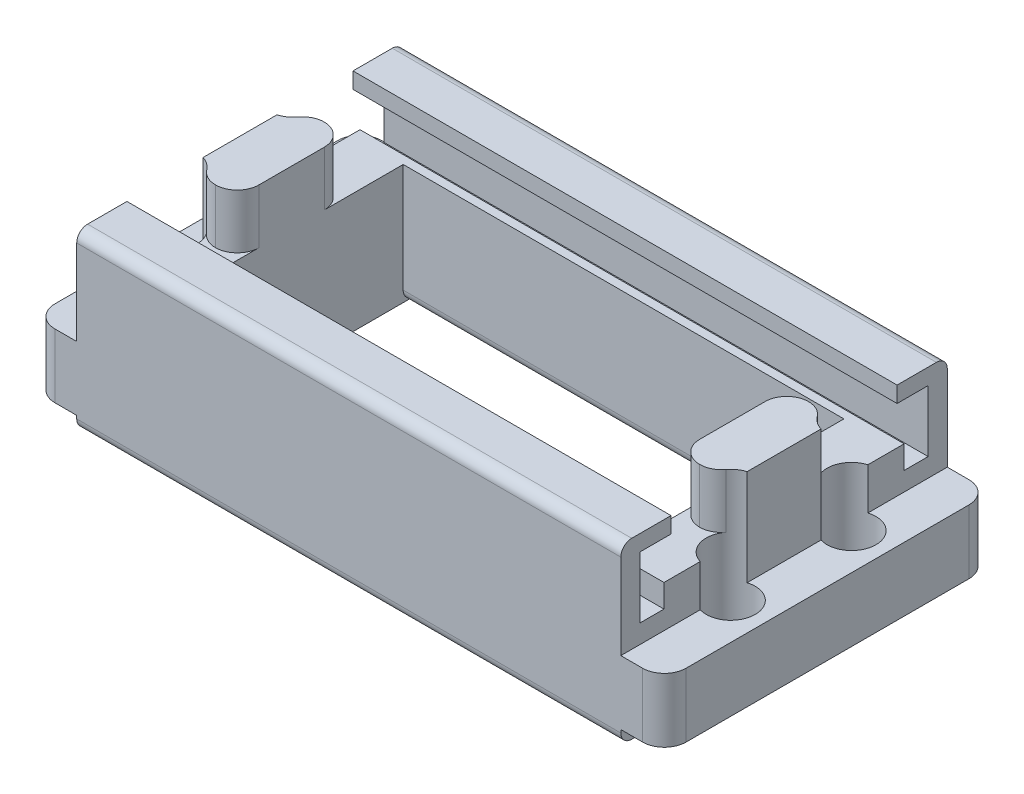
from build123d import *

# Parameters (mm, degrees)
SKETCH1_W           = 50
SKETCH1_H           = 30
BOSS_EXTRUDE1_DEPTH = 16
SKETCH2_W           = 40.5
SKETCH2_H           = 20.5
CUT_EXTRUDE1_DEPTH  = 61.464865831
SKETCH3_W           = 5.361453717
SKETCH3_H           = 2.1
SKETCH3_W_2         = 6
CUT_EXTRUDE2_DEPTH  = 1.25
SKETCH5_W           = 30
SKETCH5_H           = 5.881320982
BOSS_EXTRUDE2_DEPTH = 4
SKETCH4_R           = 2.25
CUT_EXTRUDE3_DEPTH  = 64.812224534
CUT_EXTRUDE4_DEPTH  = 64.812224534
FILLET1_R           = 1
FILLET2_R           = 2
FILLET3_R           = 2


with BuildPart() as part:
    # Sketch1 → Boss-Extrude1 (new body)
    with BuildSketch(Plane(origin=(0, 0, 0), x_dir=(1, 0, 0), z_dir=(0, 1, 0))):
        with Locations((25, 15)):
            Rectangle(SKETCH1_W, SKETCH1_H)
    extrude(amount=BOSS_EXTRUDE1_DEPTH)

    # Sketch2 → Cut-Extrude1 (cut, through all)
    with BuildSketch(Plane(origin=(0, 16, 0), x_dir=(1, 0, 0), z_dir=(0, 1, 0))):
        with Locations((25, 15)):
            Rectangle(SKETCH2_W, SKETCH2_H)
    extrude(amount=-CUT_EXTRUDE1_DEPTH, mode=Mode.SUBTRACT)

    # Sketch3 → Cut-Extrude2 (cut)
    with BuildSketch(Plane.XZ):
        with Locations((2.069273142, -15)):
            Rectangle(SKETCH3_W, SKETCH3_H)
        with Locations((47.362234217, -15)):
            Rectangle(SKETCH3_W_2, SKETCH3_H)
    extrude(amount=-CUT_EXTRUDE2_DEPTH, mode=Mode.SUBTRACT)

    # Sketch5 → Boss-Extrude2 (add)
    with BuildSketch(Plane(origin=(50, 0, 0), x_dir=(0, 0, -1), z_dir=(1, 0, 0))):
        with Locations((15, 4.219150797)):
            Rectangle(SKETCH5_W, SKETCH5_H)
    boss_extrude2 = extrude(amount=BOSS_EXTRUDE2_DEPTH)

    # Mirror1: Boss-Extrude2 across plane
    add(boss_extrude2.mirror(Plane(origin=(25, 0, 0), x_dir=(0, 0, 1), z_dir=(1, 0, 0))))

    # Sketch4 → Cut-Extrude3 (cut, through all)
    with BuildSketch(Plane.XZ):
        with Locations(Location((50.65, -20.55, 0), (0, 0, 253.208552885))):
            Circle(SKETCH4_R)
        with Locations(Location((-0.65, -20.55, 0), (0, 0, 286.791447115))):
            Circle(SKETCH4_R)
        with Locations(Location((50.65, -9.45, 0), (0, 0, 253.208552885))):
            Circle(SKETCH4_R)
        with Locations(Location((-0.65, -9.45, 0), (0, 0, 286.791447115))):
            Circle(SKETCH4_R)
    extrude(amount=-CUT_EXTRUDE3_DEPTH, mode=Mode.SUBTRACT)

    # Sketch7 → Cut-Extrude4 (cut, through all)
    with BuildSketch(Plane(origin=(50, 0, 0), x_dir=(0, 0, -1), z_dir=(1, 0, 0))):
        Polygon((26.03322218, 11), (20, 11), (20, 19.253471802), (25.386984847, 19.253471802), (25.386984847, 14.530939497), (28.241616166, 14.530939497), (28.241616166, 11), (28.241616166, 8.880902809), (26.03322218, 8.880902809), align=None)
    cut_extrude4 = extrude(amount=-CUT_EXTRUDE4_DEPTH, mode=Mode.SUBTRACT)

    # Mirror2: Cut-Extrude4 across plane
    add(cut_extrude4.mirror(Plane(origin=(0, 0, -15), x_dir=(1, 0, 0), z_dir=(0, 0, -1))), mode=Mode.SUBTRACT)

    # Fillet1
    fillet1_edges = [part.edges().sort_by_distance(p)[0] for p in [
        (25, 0, -30),
        (25, 0, 0),
        (25, 0, -4.75),
        (25, 0, -25.25),
        (25, 16, 0),
        (25, 16, -30),
    ]]
    fillet(fillet1_edges, radius=FILLET1_R)

    # Fillet2
    fillet2_edges = [part.edges().sort_by_distance(p)[0] for p in [
        (-4, 4.219150797, -30),
        (-4, 4.219150797, 0),
        (54, 4.219150797, 0),
        (54, 4.219150797, -30),
    ]]
    fillet(fillet2_edges, radius=FILLET2_R)

    # Fillet3
    fillet3_edges = [part.edges().sort_by_distance(p)[0] for p in [
        (1.531742423, 13.5, -10),
        (4.75, 13.5, -10),
        (1.531742423, 13.5, -20),
        (4.75, 13.5, -20),
        (45.25, 13.5, -10),
        (48.468257577, 13.5, -10),
        (45.25, 13.5, -20),
        (48.468257577, 13.5, -20),
    ]]
    fillet(fillet3_edges, radius=FILLET3_R - 0.0001)  # a hair under: the kernel refuses the full size


solid = part.part
